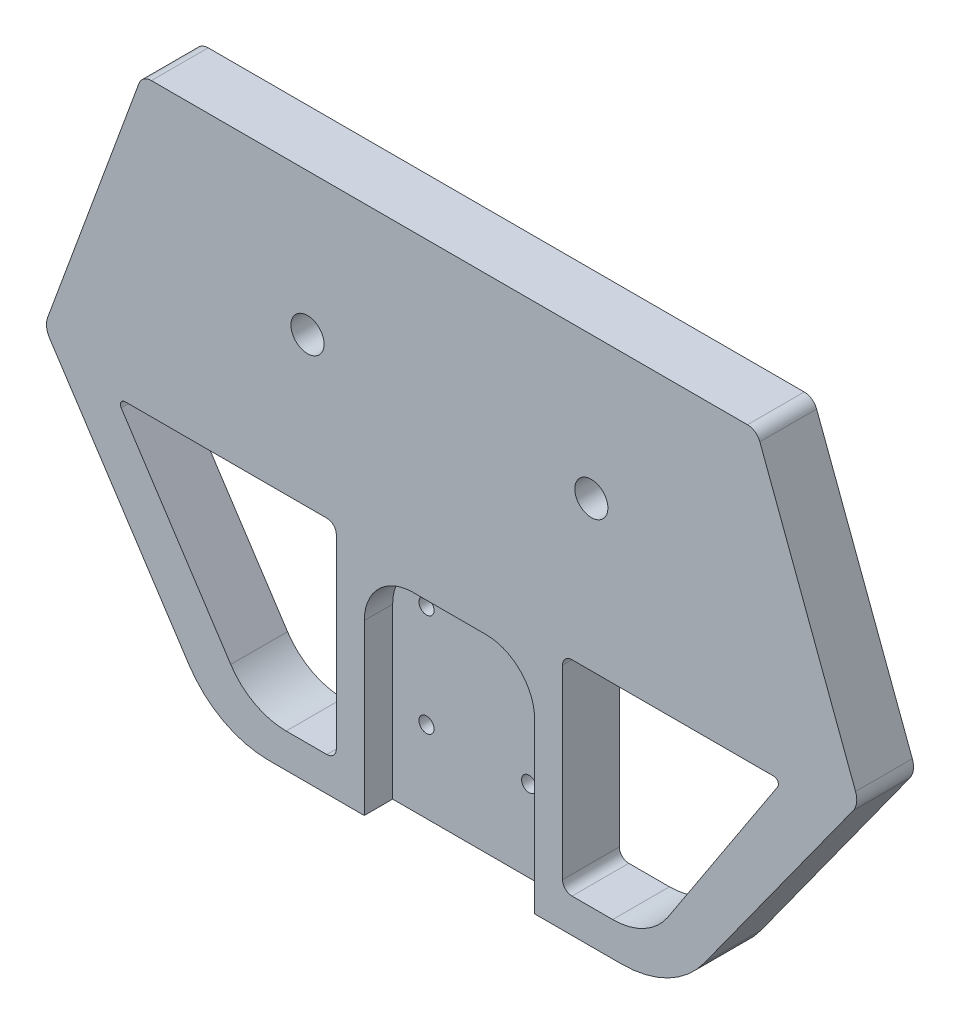
from build123d import *

# Parameters (mm, degrees)
SKETCH2_R               = 2.2225
BOSS_EXTRUDE1_DEPTH     = 7.62
CUT_EXTRUDE1_DEPTH      = 67.432289783
CUT_EXTRUDE1_DEPTH_BACK = 67.432289783
SKETCH3_R               = 1.016
CUT_EXTRUDE2_DEPTH      = 67.432289783
CUT_EXTRUDE2_DEPTH_BACK = 3.81
SKETCH5_R               = 1.905
CUT_EXTRUDE3_DEPTH      = 0.635
CUT_EXTRUDE4_DEPTH      = 67.432289783


with BuildPart() as part:
    # Sketch2 → Boss-Extrude1 (new body)
    with BuildSketch(Plane.XY):
        with BuildLine():
            Line((40.005, 34.194483756), (-40.005, 34.194483756))
            ThreePointArc((-40.005, 34.194483756), (-41.022456018, 33.874587748), (-41.673792668, 33.030010472))
            Line((-41.673792668, 33.030010472), (-53.9331315, -0.315391152))
            ThreePointArc((-53.9331315, -0.315391152), (-54.072783991, -1.479661595), (-53.674573059, -2.582592481))
            Line((-53.674573059, -2.582592481), (-34.960140606, -31.183474844))
            ThreePointArc((-34.960140606, -31.183474844), (-30.355254316, -35.418112764), (-24.290448915, -36.952802142))
            Line((-24.290448915, -36.952802142), (23.120329829, -36.952802142))
            ThreePointArc((23.120329829, -36.952802142), (29.348501846, -35.451873895), (34.209252745, -31.278624206))
            Line((34.209252745, -31.278624206), (54.197958002, -3.566194159))
            ThreePointArc((54.197958002, -3.566194159), (54.655517845, -2.416926445), (54.515959424, -1.187820779))
            Line((54.515959424, -1.187820779), (41.66962629, 33.041226355))
            ThreePointArc((41.66962629, 33.041226355), (41.017544236, 33.878002887), (40.005, 34.194483756))
        make_face()
        with Locations((-19.05, 15.144483756)):
            Circle(SKETCH2_R, mode=Mode.SUBTRACT)
        with Locations((19.05, 15.144483756)):
            Circle(SKETCH2_R, mode=Mode.SUBTRACT)
    extrude(amount=BOSS_EXTRUDE1_DEPTH)

    # Sketch3 → Cut-Extrude1 (cut, two sides: drawn at the far end of the back side and taken through both)
    with BuildSketch(Plane.XY.offset(7.62).offset(-CUT_EXTRUDE1_DEPTH_BACK)):
        with Locations((-6.886956, -26.030802142)):
            Circle(SKETCH3_R)
        with Locations((-6.886956, -12.256890142)):
            Circle(SKETCH3_R)
        with Locations((6.886956, -12.256890142)):
            Circle(SKETCH3_R)
        with Locations((6.886956, -26.030802142)):
            Circle(SKETCH3_R)
    extrude(amount=CUT_EXTRUDE1_DEPTH + CUT_EXTRUDE1_DEPTH_BACK, mode=Mode.SUBTRACT)

    # Sketch4 → Cut-Extrude2 (cut, two sides: drawn at the far end of the back side and taken through both)
    with BuildSketch(Plane.XY.offset(7.62).offset(-CUT_EXTRUDE2_DEPTH_BACK)):
        with BuildLine():
            Line((4.884652225, -7.742058071), (-4.884652225, -7.742058071))
            ThreePointArc((-4.884652225, -7.742058071), (-9.512912022, -9.659146049), (-11.43, -14.287405846))
            Line((-11.43, -14.287405846), (-11.43, -37.587058071))
            Line((-11.43, -37.587058071), (11.43, -37.587058071))
            Line((11.43, -37.587058071), (11.43, -14.287405846))
            ThreePointArc((11.43, -14.287405846), (9.512912022, -9.659146049), (4.884652225, -7.742058071))
        make_face()
    extrude(amount=CUT_EXTRUDE2_DEPTH + CUT_EXTRUDE2_DEPTH_BACK, mode=Mode.SUBTRACT)

    # Sketch5 → Cut-Extrude3 (cut)
    with BuildSketch(Plane(origin=(0, 0, 0), x_dir=(-1, 0, 0), z_dir=(0, 0, -1))):
        with Locations((-6.886956, -12.256890142)):
            Circle(SKETCH5_R)
        with Locations((-6.886956, -26.030802142)):
            Circle(SKETCH5_R)
        with Locations((6.886956, -26.030802142)):
            Circle(SKETCH5_R)
        with Locations((6.886956, -12.256890142)):
            Circle(SKETCH5_R)
    extrude(amount=-CUT_EXTRUDE3_DEPTH, mode=Mode.SUBTRACT)

    # Sketch6 → Cut-Extrude4 (cut, through all)
    with BuildSketch(Plane.XY.offset(7.62)):
        with BuildLine():
            Line((-44.056637344, -5.881169679), (-29.353866797, -28.351111628))
            ThreePointArc((-29.353866797, -28.351111628), (-26.143297026, -31.303540775), (-21.914858001, -32.373540556))
            Line((-21.914858001, -32.373540556), (-16.452977044, -32.373540556))
            ThreePointArc((-16.452977044, -32.373540556), (-15.554951432, -32.001566168), (-15.182977044, -31.103540556))
            Line((-15.182977044, -31.103540556), (-15.182977044, -6.168486031))
            ThreePointArc((-15.182977044, -6.168486031), (-15.554951432, -5.270460419), (-16.452977044, -4.898486031))
            Line((-16.452977044, -4.898486031), (-43.525279573, -4.898486031))
            ThreePointArc((-43.525279573, -4.898486031), (-44.083851017, -5.231454672), (-44.056637344, -5.881169679))
        make_face()
        with BuildLine():
            Line((16.452977044, -32.373540556), (21.914858001, -32.373540556))
            ThreePointArc((21.914858001, -32.373540556), (26.143297026, -31.303540775), (29.353866797, -28.351111628))
            Line((29.353866797, -28.351111628), (44.056637344, -5.881169679))
            ThreePointArc((44.056637344, -5.881169679), (44.083851017, -5.231454672), (43.525279573, -4.898486031))
            Line((43.525279573, -4.898486031), (16.452977044, -4.898486031))
            ThreePointArc((16.452977044, -4.898486031), (15.554951432, -5.270460419), (15.182977044, -6.168486031))
            Line((15.182977044, -6.168486031), (15.182977044, -31.103540556))
            ThreePointArc((15.182977044, -31.103540556), (15.554951432, -32.001566168), (16.452977044, -32.373540556))
        make_face()
    extrude(amount=-CUT_EXTRUDE4_DEPTH, mode=Mode.SUBTRACT)


solid = part.part
